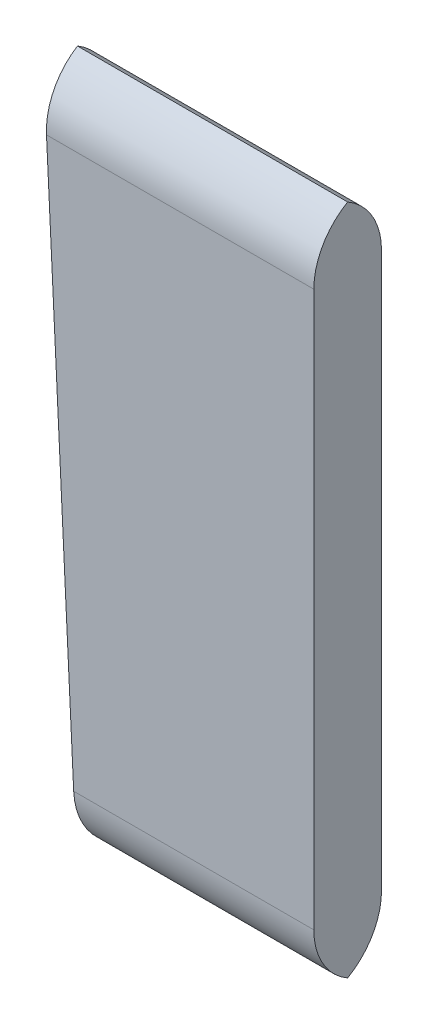
from build123d import *

# Parameters (mm, degrees)
BOSS_EXTRUDE1_DEPTH = 10
FILLET1_R           = 10
FILLET2_R           = 10


with BuildPart() as part:
    # Sketch2 → Boss-Extrude1 (new body)
    with BuildSketch(Plane.XY):
        Polygon((-10.989010989, 64.197802198), (29.010989011, 64.197802198), (29.010989011, -37.802197802), (-5.989010989, -37.802197802), align=None)
    extrude(amount=BOSS_EXTRUDE1_DEPTH)

    # Fillet1
    # the kernel refuses this fillet: 10 mm, written as the material it takes off along each edge
    with BuildSketch(Plane(origin=(-35.989010989, 64.197802198, 0), x_dir=(0, 0, 1), z_dir=(1, 0, 0))) as fillet1_piece_1:
        with BuildLine():
            CenterArc((FILLET1_R, FILLET1_R), FILLET1_R, 180, 90)
            Line((0, FILLET1_R), (0, 0))
            Line((0, 0), (FILLET1_R, 0))
        make_face()
    extrude(amount=90, mode=Mode.SUBTRACT)
    with BuildSketch(Plane(origin=(-35.989010989, 64.197802198, 10), x_dir=(0, 0, -1), z_dir=(1, 0, 0))) as fillet1_piece_2:
        with BuildLine():
            CenterArc((FILLET1_R, -FILLET1_R), FILLET1_R, 90, 90)
            Line((0, -FILLET1_R), (0, 0))
            Line((0, 0), (FILLET1_R, 0))
        make_face()
    extrude(amount=90, mode=Mode.SUBTRACT)

    # Fillet2
    # the kernel refuses this fillet: 10 mm, written as the material it takes off along each edge
    with BuildSketch(Plane(origin=(54.010989011, -37.802197802, 0), x_dir=(0, 0, 1), z_dir=(-1, 0, 0)), Plane(origin=(54.010989011, -37.802197802, 10), x_dir=(0, 1, 0), z_dir=(-1, 0, 0))) as fillet2_piece_1:
        with BuildLine():
            CenterArc((FILLET2_R, FILLET2_R), FILLET2_R, 180, 90)
            Line((0, FILLET2_R), (0, 0))
            Line((0, 0), (FILLET2_R, 0))
        make_face()
    extrude(amount=85, mode=Mode.SUBTRACT)


solid = part.part
